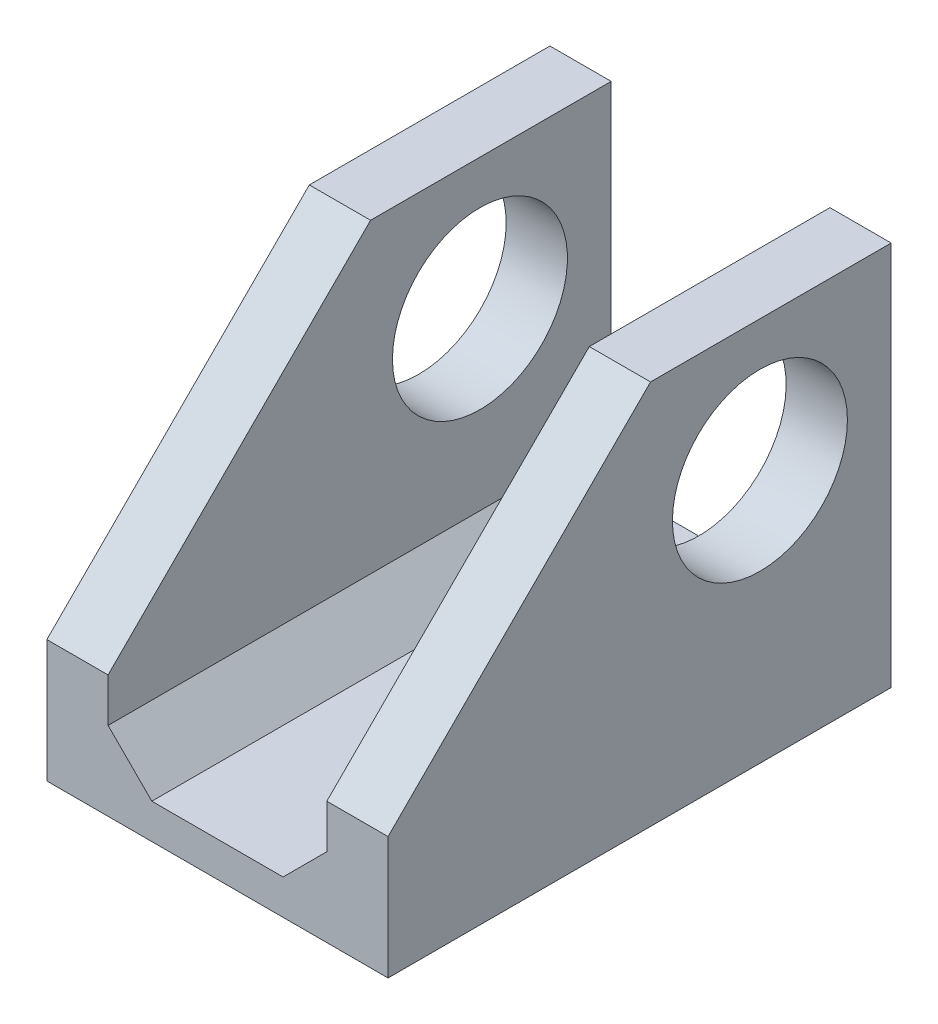
from build123d import *

# Parameters (mm, degrees)
BOSS_EXTRUDE1_DEPTH      = 85
BOSS_EXTRUDE1_DEPTH_BACK = 30
CUT_EXTRUDE1_DEPTH       = 134.120246394
CUT_EXTRUDE1_DEPTH_BACK  = 134.120246394
SKETCH3_R                = 20
CHAMFER1_SIZE            = 10
CHAMFER2_SIZE            = 60


with BuildPart() as part:
    # Sketch2 → Boss-Extrude1 (new, two sides: drawn at the far end of the back side and taken through both)
    with BuildSketch(Plane.XY.offset(-BOSS_EXTRUDE1_DEPTH_BACK)):
        Polygon((0, 0), (-50, 0), (-50, 80), (-64, 80), (-64, -8), (14, -8), (14, 80), (0, 80), align=None)
    extrude(amount=BOSS_EXTRUDE1_DEPTH + BOSS_EXTRUDE1_DEPTH_BACK)

    # Sketch3 → Cut-Extrude1 (cut, two sides: drawn at the far end of the back side and taken through both)
    with BuildSketch(Plane(origin=(0, 0, 0), x_dir=(0, 0, -1), z_dir=(1, 0, 0)).offset(-CUT_EXTRUDE1_DEPTH_BACK)):
        with Locations((0, 50)):
            Circle(SKETCH3_R)
    extrude(amount=CUT_EXTRUDE1_DEPTH + CUT_EXTRUDE1_DEPTH_BACK, mode=Mode.SUBTRACT)

    # Chamfer1
    chamfer1_edges = [part.edges().sort_by_distance(p)[0] for p in [
        (-50, 0, 27.5),
        (0, 0, 27.5),
    ]]
    chamfer(chamfer1_edges, length=CHAMFER1_SIZE)

    # Chamfer2
    chamfer2_edges = [part.edges().sort_by_distance(p)[0] for p in [
        (7, 80, 85),
        (-57, 80, 85),
    ]]
    chamfer(chamfer2_edges, length=CHAMFER2_SIZE)


solid = part.part
